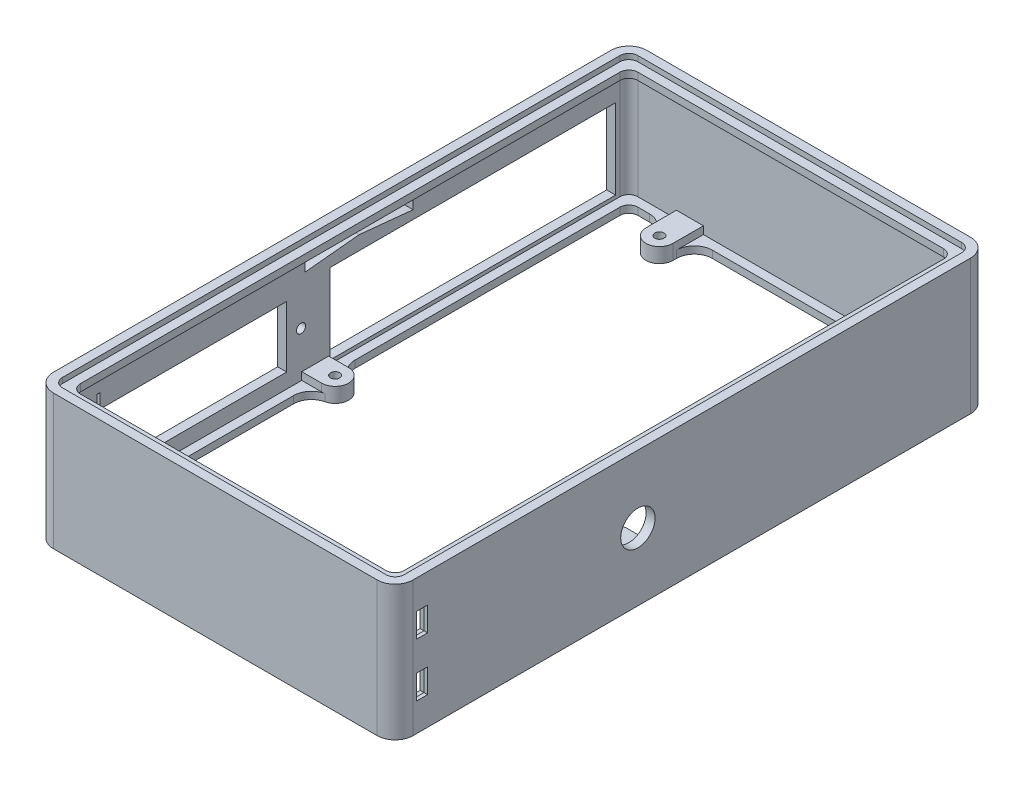
from build123d import *

# Parameters (mm, degrees)
SKETCH1_W            = 200
SKETCH1_H            = 330
BOSS_EXTRUDE1_DEPTH  = 75
FILLET1_R            = 10
CUT_EXTRUDE1_DEPTH   = 75
SKETCH3_W            = 180
SKETCH3_H            = 310
BOSS_EXTRUDE2_DEPTH  = 4
BOSS_EXTRUDE3_START  = -4
SKETCH4_W            = 180
SKETCH4_H            = 310
BOSS_EXTRUDE3_DEPTH  = 4
SKETCH8_W            = 158.75
SKETCH8_H            = 44.5
CUT_EXTRUDE2_DEPTH   = 40
BOSS_EXTRUDE4_START  = -8.23
SKETCH11_R           = 2.55
BOSS_EXTRUDE4_DEPTH  = 8.23
SKETCH12_R           = 2.55
SKETCH12_W           = 101.8
SKETCH12_H           = 34
CUT_EXTRUDE3_DEPTH   = 31.23
SKETCH13_R           = 9.55
CUT_EXTRUDE4_DEPTH   = 31.23
FILLET2_R            = 10
FILLET3_R            = 20
FILLET4_R            = 5
CUT_EXTRUDE5_DEPTH   = 10
SKETCH15_W           = 2
SKETCH15_H           = 47.02140159
BOSS_EXTRUDE5_DEPTH  = 8
SKETCH16_R           = 2.55
CUT_EXTRUDE6_DEPTH   = 2
BOSS_EXTRUDE6_START  = 3
SKETCH17_R           = 4.5
SKETCH17_R_2         = 2.55
BOSS_EXTRUDE6_DEPTH  = 3
CHAMFER1_SIZE        = 3
FILLET5_R            = 5
CHAMFER2_SIZE        = 3
SKETCH19_W           = 7
SKETCH19_H           = 14.5
CUT_EXTRUDE8_DEPTH   = 18
SKETCH22_W           = 7
SKETCH22_H           = 0.375
CUT_EXTRUDE9_DEPTH   = 18
SKETCH23_W           = 7
SKETCH23_H           = 0.375
BOSS_EXTRUDE7_DEPTH  = 5
SKETCH20_R           = 2.55
CUT_EXTRUDE10_DEPTH  = 18
SKETCH24_W           = 8
SKETCH24_H           = 15.5
CUT_EXTRUDE12_DEPTH  = 10
SKETCH25_W           = 8
SKETCH25_H           = 0.4
BOSS_EXTRUDE8_DEPTH  = 5
SKETCH26_W           = 0.1
SKETCH26_H           = 15.1
BOSS_EXTRUDE9_DEPTH  = 5
BOSS_EXTRUDE10_DEPTH = 2
SKETCH28_W           = 12.985784693
SKETCH28_H           = 10.415883014
BOSS_EXTRUDE11_DEPTH = 5
BOSS_EXTRUDE12_START = -0.6
SKETCH29_R           = 2.55
BOSS_EXTRUDE12_DEPTH = 0.6
CUT_EXTRUDE13_DEPTH  = 5


with BuildPart() as part:
    # Sketch1 → Boss-Extrude1 (new body)
    with BuildSketch(Plane(origin=(0, 0, 0), x_dir=(1, 0, 0), z_dir=(0, 1, 0))):
        with Locations((100, 165)):
            Rectangle(SKETCH1_W, SKETCH1_H)
    extrude(amount=BOSS_EXTRUDE1_DEPTH)

    # Fillet1
    fillet1_edges = [part.edges().sort_by_distance(p)[0] for p in [
        (0, 37.5, -330),
        (200, 37.5, -330),
        (200, 37.5, 0),
        (0, 37.5, 0),
    ]]
    fillet(fillet1_edges, radius=FILLET1_R)

    # Sketch2 → Cut-Extrude1 (cut)
    with BuildSketch(Plane(origin=(0, 75, 0), x_dir=(1, 0, 0), z_dir=(0, 1, 0))):
        with BuildLine():
            Line((190, 325), (10, 325))
            ThreePointArc((10, 325), (6.464466094, 323.535533906), (5, 320))
            Line((5, 320), (5, 10))
            ThreePointArc((5, 10), (6.464466094, 6.464466094), (10, 5))
            Line((10, 5), (190, 5))
            ThreePointArc((190, 5), (193.535533906, 6.464466094), (195, 10))
            Line((195, 10), (195, 320))
            ThreePointArc((195, 320), (193.535533906, 323.535533906), (190, 325))
        make_face()
    extrude(amount=-CUT_EXTRUDE1_DEPTH, mode=Mode.SUBTRACT)

    # Sketch3 → Boss-Extrude2 (add)
    with BuildSketch(Plane(origin=(0, 72, 0), x_dir=(1, 0, 0), z_dir=(0, 1, 0))):
        with BuildLine():
            Line((10, 5), (190, 5))
            ThreePointArc((190, 5), (193.535533906, 6.464466094), (195, 10))
            Line((195, 10), (195, 320))
            ThreePointArc((195, 320), (193.535533906, 323.535533906), (190, 325))
            Line((190, 325), (10, 325))
            ThreePointArc((10, 325), (6.464466094, 323.535533906), (5, 320))
            Line((5, 320), (5, 10))
            ThreePointArc((5, 10), (6.464466094, 6.464466094), (10, 5))
        make_face()
        with Locations((100, 165)):
            Rectangle(SKETCH3_W, SKETCH3_H, mode=Mode.SUBTRACT)
    extrude(amount=-BOSS_EXTRUDE2_DEPTH)

    # Sketch4 → Boss-Extrude3 (add)
    with BuildSketch(Plane(origin=(0, 3, 0), x_dir=(-1, 0, 0), z_dir=(0, -1, 0)).offset(BOSS_EXTRUDE3_START)):
        with BuildLine():
            Line((-5, 10), (-5, 320))
            ThreePointArc((-5, 320), (-6.464466094, 323.535533906), (-10, 325))
            Line((-10, 325), (-190, 325))
            ThreePointArc((-190, 325), (-193.535533906, 323.535533906), (-195, 320))
            Line((-195, 320), (-195, 10))
            ThreePointArc((-195, 10), (-193.535533906, 6.464466094), (-190, 5))
            Line((-190, 5), (-10, 5))
            ThreePointArc((-10, 5), (-6.464466094, 6.464466094), (-5, 10))
        make_face()
        with Locations((-100, 165)):
            Rectangle(SKETCH4_W, SKETCH4_H, mode=Mode.SUBTRACT)
    extrude(amount=BOSS_EXTRUDE3_DEPTH)

    # Sketch8 → Cut-Extrude2 (cut)
    with BuildSketch(Plane(origin=(5, 0, 0), x_dir=(0, 0, -1), z_dir=(1, 0, 0))):
        with Locations((238.245, 31.25)):
            Rectangle(SKETCH8_W, SKETCH8_H)
    extrude(amount=-CUT_EXTRUDE2_DEPTH, mode=Mode.SUBTRACT)

    # Sketch11 → Boss-Extrude4 (add)
    # profile 1 of 4: a face of its own
    with BuildSketch(Plane.XZ.offset(-3).offset(BOSS_EXTRUDE4_START)):
        with BuildLine():
            Line((16.06, -158.09), (10, -158.09))
            Line((10, -158.09), (5, -158.09))
            Line((5, -158.09), (5, -143.09))
            Line((5, -143.09), (10, -143.09))
            Line((10, -143.09), (16.06, -143.09))
            ThreePointArc((16.06, -143.09), (23.56, -150.59), (16.06, -158.09))
        make_face()
        with Locations(Location((16.06, -150.59, 0), (0, 0, 270))):
            Circle(SKETCH11_R, mode=Mode.SUBTRACT)
    # profile 2 of 4: a face of its own
    with BuildSketch(Plane.XZ.offset(-3).offset(BOSS_EXTRUDE4_START)):
        with BuildLine():
            Line((31.42, -308.07), (31.42, -320))
            Line((31.42, -320), (31.42, -325))
            Line((31.42, -325), (46.42, -325))
            Line((46.42, -325), (46.42, -320))
            Line((46.42, -320), (46.42, -308.07))
            ThreePointArc((46.42, -308.07), (38.92, -300.57), (31.42, -308.07))
        make_face()
        with Locations(Location((38.92, -308.07, 0), (0, 0, 270))):
            Circle(SKETCH11_R, mode=Mode.SUBTRACT)
    # profile 3 of 4: a face of its own
    with BuildSketch(Plane.XZ.offset(-3).offset(BOSS_EXTRUDE4_START)):
        with BuildLine():
            Line((171, -300.57), (190, -300.57))
            Line((190, -300.57), (195, -300.57))
            Line((195, -300.57), (195, -320))
            ThreePointArc((195, -320), (193.535533906, -323.535533906), (190, -325))
            Line((190, -325), (163.5, -325))
            Line((163.5, -325), (163.5, -320))
            Line((163.5, -320), (163.5, -308.07))
            ThreePointArc((163.5, -308.07), (165.696699141, -302.766699141), (171, -300.57))
        make_face()
        with Locations(Location((171, -308.07, 0), (0, 0, 270))):
            Circle(SKETCH11_R, mode=Mode.SUBTRACT)
    # profile 4 of 4: a face of its own
    with BuildSketch(Plane.XZ.offset(-3).offset(BOSS_EXTRUDE4_START)):
        with BuildLine():
            Line((171, -158.09), (190, -158.09))
            Line((190, -158.09), (195, -158.09))
            Line((195, -158.09), (195, -143.09))
            Line((195, -143.09), (190, -143.09))
            Line((190, -143.09), (171, -143.09))
            ThreePointArc((171, -143.09), (163.5, -150.59), (171, -158.09))
        make_face()
        with Locations(Location((171, -150.59, 0), (0, 0, 270))):
            Circle(SKETCH11_R, mode=Mode.SUBTRACT)
    extrude(amount=BOSS_EXTRUDE4_DEPTH)

    # Sketch12 → Cut-Extrude3 (cut)
    with BuildSketch(Plane.ZY):
        with Locations((-142.7, 32.25)):
            Circle(SKETCH12_R)
        with Locations((-83.8, 32.25)):
            Rectangle(SKETCH12_W, SKETCH12_H)
    extrude(amount=-CUT_EXTRUDE3_DEPTH, mode=Mode.SUBTRACT)

    # Sketch13 → Cut-Extrude4 (cut)
    with BuildSketch(Plane.ZY.offset(-195)):
        with Locations((-135, 37.5)):
            Circle(SKETCH13_R)
    extrude(amount=-CUT_EXTRUDE4_DEPTH, mode=Mode.SUBTRACT)

    # Fillet2
    # the kernel refuses this fillet: 10 mm, written as the material it adds along each edge
    with BuildSketch(Plane(origin=(31.42, 3, -320), x_dir=(0, 0, 1), z_dir=(0, 1, 0))) as fillet2_piece_1:
        with BuildLine():
            CenterArc((FILLET2_R, -FILLET2_R), FILLET2_R, 90, 90)
            Line((0, -FILLET2_R), (0, 0))
            Line((0, 0), (FILLET2_R, 0))
        make_face()
    extrude(amount=4)
    with BuildSketch(Plane(origin=(46.42, 7, -320), x_dir=(1, 0, 0), z_dir=(0, -1, 0))) as fillet2_piece_2:
        with BuildLine():
            CenterArc((FILLET2_R, FILLET2_R), FILLET2_R, 180, 90)
            Line((0, FILLET2_R), (0, 0))
            Line((0, 0), (FILLET2_R, 0))
        make_face()
    extrude(amount=4)
    with BuildSketch(Plane(origin=(10, 7, -143.09), x_dir=(0.9996913663867205, 0, -0.02484294611859972), z_dir=(0, -1, 0))) as fillet2_piece_3:
        with BuildLine():
            CenterArc((9.759646117, 9.796182659), FILLET2_R, 181.423542417, 76.988721184)
            Line((-0.237267547, 9.547753198), (-1.236958913, 9.522910252))
            Line((-1.236958913, 9.522910252), (-0.999691366, -0.024842946))
            Line((-0.999691366, -0.024842946), (0.024842946, -0.999691366))
            ThreePointArc((0.024842946, -0.999691366), (6.082972626, -0.849143113), (7.550095388, -0.979618266))
            Line((7.550095388, -0.979618266), (7.750963636, 0))
        make_face()
    extrude(amount=4)
    with BuildSketch(Plane(origin=(10, 3, -158.09), x_dir=(0, 0, -1), z_dir=(0, 1, 0))) as fillet2_piece_4:
        with BuildLine():
            CenterArc((9.550700865, -10), FILLET2_R, 90, 76.988721184)
            Line((-0.192556772, -7.748571429), (-1.166882536, -7.523428571))
            ThreePointArc((-1.166882536, -7.523428571), (-1, -6.06), (-1, 0))
            Line((-1, 0), (0, 1))
            Line((0, 1), (9.550700865, 1))
            Line((9.550700865, 1), (9.550700865, 0))
        make_face()
    extrude(amount=4)

    # Fillet3
    # the kernel refuses this fillet: 20 mm, written as the material it adds along each edge
    with BuildSketch(Plane(origin=(190, 7, -143.09), x_dir=(-0.9999999668790588, 0, -0.00025737498219353277), z_dir=(0, -1, 0))) as fillet3_piece_1:
        with BuildLine():
            CenterArc((19.994856519, -19.986959005), FILLET3_R, 92.069195834, 87.916057665)
            Line((-0.005142819, -19.981811506), (-2.005142752, -19.981296756))
            Line((-2.005142752, -19.981296756), (-1.999999934, 0.00051475))
            Line((-1.999999934, 0.00051475), (0.00051475, 1.999999934))
            ThreePointArc((0.00051475, 1.999999934), (19.000514121, 1.995109809), (19.20051505, 1.998695901))
            Line((19.20051505, 1.998695901), (19.272727911, 0))
        make_face()
    extrude(amount=4)
    with BuildSketch(Plane(origin=(190, 3, -158.09), x_dir=(0, 0, -1), z_dir=(0, 1, 0))) as fillet3_piece_2:
        with BuildLine():
            CenterArc((19.981812167, 20), FILLET3_R, 182.083942335, 87.916057665)
            Line((-0.004960318, 19.272727273), (-2.003637567, 19.2))
            ThreePointArc((-2.003637567, 19.2), (-2, 19), (-2, 0))
            Line((-2, 0), (0, -2))
            Line((0, -2), (19.981812167, -2))
            Line((19.981812167, -2), (19.981812167, 0))
        make_face()
    extrude(amount=4)

    # Fillet4
    fillet4_edges = [part.edges().sort_by_distance(p)[0] for p in [
        (10, 5, -320),
        (10, 5, -10),
        (190, 5, -10),
        (10, 70, -10),
        (10, 70, -320),
        (190, 70, -320),
        (190, 70, -10),
    ]]
    fillet(fillet4_edges, radius=FILLET4_R)

    # Sketch14 → Cut-Extrude5 (cut)
    with BuildSketch(Plane.ZY):
        Polygon((-30.9, 49.25), (-30.9, 15.25), (-30.9, 10.25), (-29.15, 10.25), (-29.15, 57.25), (-30.9, 57.25), align=None)
    extrude(amount=-CUT_EXTRUDE5_DEPTH, mode=Mode.SUBTRACT)

    # Sketch15 → Boss-Extrude5 (add)
    with BuildSketch(Plane.ZY):
        with Locations((-31.9, 33.760700795)):
            Rectangle(SKETCH15_W, SKETCH15_H)
    extrude(amount=BOSS_EXTRUDE5_DEPTH)

    # Sketch16 → Cut-Extrude6 (cut)
    with BuildSketch(Plane(origin=(0, 0, -32.9), x_dir=(-1, 0, 0), z_dir=(0, 0, -1))):
        with Locations((0.5, 31.75)):
            Circle(SKETCH16_R)
    extrude(amount=-CUT_EXTRUDE6_DEPTH, mode=Mode.SUBTRACT)

    # Sketch17 → Boss-Extrude6 (add)
    with BuildSketch(Plane(origin=(0, 0, -32.9), x_dir=(-1, 0, 0), z_dir=(0, 0, -1)).offset(BOSS_EXTRUDE6_START)):
        with Locations((0.5, 31.75)):
            Circle(SKETCH17_R)
        with Locations((0.5, 31.75)):
            Circle(SKETCH17_R_2, mode=Mode.SUBTRACT)
    extrude(amount=-BOSS_EXTRUDE6_DEPTH)

    # Chamfer1
    # the kernel refuses this chamfer: 3 mm, written as the material it adds along each edge
    with BuildSketch(Plane(origin=(-0.5, 31.75, -32.9), x_dir=(-1, 0, 0), z_dir=(0, -1, 0))) as chamfer1_piece_1_section:
        Polygon((4.5, CHAMFER1_SIZE), (4.5 + CHAMFER1_SIZE, 0), (4.5, 0), align=None)
    chamfer1_piece_1 = revolve(axis=Axis((-0.5, 31.75, -32.9), (0, 0, -1)), mode=Mode.PRIVATE)
    chamfer1_piece_1 = split(chamfer1_piece_1, bisect_by=Plane(origin=(5, 36.059247984, -35.347606696), z_dir=(-1, 0, 0)), keep=Keep.TOP, mode=Mode.PRIVATE)
    chamfer1_piece_1 = split(chamfer1_piece_1, bisect_by=Plane(origin=(-8, 36.059247984, -35.347606696), z_dir=(1, 0, 0)), keep=Keep.TOP, mode=Mode.PRIVATE)
    chamfer1_piece_1 = split(chamfer1_piece_1, bisect_by=Plane(origin=(-2.987945483, 36.059247984, -35.9), z_dir=(0, 0, 1)), keep=Keep.TOP, mode=Mode.PRIVATE)
    add(chamfer1_piece_1)

    # Fillet5
    fillet5_edges = [part.edges().sort_by_distance(p)[0] for p in [
        (-8, 57.27140159, -31.9),
        (-8, 10.25, -31.9),
    ]]
    fillet(fillet5_edges, radius=FILLET5_R)

    # Chamfer2
    chamfer2_edges = [part.edges().sort_by_distance(p)[0] for p in [
        (0, 53.260700795, -32.9),
        (0, 12.75, -32.9),
    ]]
    chamfer(chamfer2_edges, length=CHAMFER2_SIZE)

    # Sketch19 → Cut-Extrude8 (cut)
    with BuildSketch(Plane(origin=(200, 0, 0), x_dir=(0, 0, -1), z_dir=(1, 0, 0))):
        with Locations((15, 52)):
            Rectangle(SKETCH19_W, SKETCH19_H)
        with Locations((15, 22.25)):
            Rectangle(SKETCH19_W, SKETCH19_H)
    extrude(amount=-CUT_EXTRUDE8_DEPTH, mode=Mode.SUBTRACT)

    # Sketch22 → Cut-Extrude9 (cut)
    with BuildSketch(Plane(origin=(200, 0, 0), x_dir=(0, 0, -1), z_dir=(1, 0, 0))):
        with Locations((15, 59.4375)):
            Rectangle(SKETCH22_W, SKETCH22_H)
        with Locations((15, 29.6875)):
            Rectangle(SKETCH22_W, SKETCH22_H)
    extrude(amount=-CUT_EXTRUDE9_DEPTH, mode=Mode.SUBTRACT)

    # Sketch23 → Boss-Extrude7 (add)
    with BuildSketch(Plane(origin=(200, 0, 0), x_dir=(0, 0, -1), z_dir=(1, 0, 0))):
        with Locations((15, 44.9375)):
            Rectangle(SKETCH23_W, SKETCH23_H)
        with Locations((15, 15.1875)):
            Rectangle(SKETCH23_W, SKETCH23_H)
    extrude(amount=-BOSS_EXTRUDE7_DEPTH)

    # Sketch20 → Cut-Extrude10 (cut)
    with BuildSketch(Plane(origin=(0, 0, -5), x_dir=(-1, 0, 0), z_dir=(0, 0, -1))):
        with Locations((-178, 37.125)):
            Circle(SKETCH20_R)
        with Locations((-168, 62.125)):
            Circle(SKETCH20_R)
        with Locations((-168, 12.125)):
            Circle(SKETCH20_R)
    extrude(amount=-CUT_EXTRUDE10_DEPTH, mode=Mode.SUBTRACT)

    # Sketch24 → Cut-Extrude12 (cut)
    with BuildSketch(Plane(origin=(200, 0, 0), x_dir=(0, 0, -1), z_dir=(1, 0, 0))):
        with Locations((15, 22.625)):
            Rectangle(SKETCH24_W, SKETCH24_H)
        with Locations((15, 52.375)):
            Rectangle(SKETCH24_W, SKETCH24_H)
    extrude(amount=-CUT_EXTRUDE12_DEPTH, mode=Mode.SUBTRACT)

    # Sketch25 → Boss-Extrude8 (add)
    with BuildSketch(Plane(origin=(200, 0, 0), x_dir=(0, 0, -1), z_dir=(1, 0, 0))):
        with Locations((15, 59.925)):
            Rectangle(SKETCH25_W, SKETCH25_H)
        with Locations((15, 30.175)):
            Rectangle(SKETCH25_W, SKETCH25_H)
    extrude(amount=-BOSS_EXTRUDE8_DEPTH)

    # Sketch26 → Boss-Extrude9 (add)
    with BuildSketch(Plane(origin=(200, 0, 0), x_dir=(0, 0, -1), z_dir=(1, 0, 0))):
        with Locations((11.05, 52.175)):
            Rectangle(SKETCH26_W, SKETCH26_H)
        with Locations((18.95, 52.175)):
            Rectangle(SKETCH26_W, SKETCH26_H)
        with Locations((18.95, 22.425)):
            Rectangle(SKETCH26_W, SKETCH26_H)
        with Locations((11.05, 22.425)):
            Rectangle(SKETCH26_W, SKETCH26_H)
    extrude(amount=-BOSS_EXTRUDE9_DEPTH)

    # Sketch27 → Boss-Extrude10 (add)
    with BuildSketch(Plane(origin=(200, 0, 0), x_dir=(0, 0, -1), z_dir=(1, 0, 0))):
        Polygon((18.05, 22.425), (18.9, 22.425), (18.9, 29.975), (11.1, 29.975), (11.1, 22.425), (11.95, 22.425), (11.95, 29.125), (15, 29.125), (18.05, 29.125), align=None)
        Polygon((18.9, 14.875), (18.9, 22.425), (18.05, 22.425), (18.05, 15.725), (11.95, 15.725), (11.95, 22.425), (11.1, 22.425), (11.1, 14.875), align=None)
        Polygon((18.9, 44.625), (18.9, 52.175), (18.05, 52.175), (18.05, 45.475), (11.95, 45.475), (11.95, 52.175), (11.1, 52.175), (11.1, 44.625), align=None)
        Polygon((18.05, 52.175), (18.9, 52.175), (18.9, 59.725), (11.1, 59.725), (11.1, 52.175), (11.95, 52.175), (11.95, 58.875), (15, 58.875), (18.05, 58.875), align=None)
    extrude(amount=-BOSS_EXTRUDE10_DEPTH)

    # Sketch28 → Boss-Extrude11 (add)
    with BuildSketch(Plane(origin=(0, 0, -5), x_dir=(-1, 0, 0), z_dir=(0, 0, -1))):
        with Locations((-176.768468334, 36.353971187)):
            Rectangle(SKETCH28_W, SKETCH28_H)
    extrude(amount=-BOSS_EXTRUDE11_DEPTH)

    # Sketch29 → Boss-Extrude12 (add)
    with BuildSketch(Plane.XY.offset(BOSS_EXTRUDE12_START)):
        with Locations(Location((168, 62.125, 0), (0, 0, 180))):
            Circle(SKETCH29_R)
        with Locations(Location((168, 12.125, 0), (0, 0, 180))):
            Circle(SKETCH29_R)
    extrude(amount=BOSS_EXTRUDE12_DEPTH)

    # Sketch31 → Cut-Extrude13 (cut)
    with BuildSketch(Plane.ZY):
        Polygon((-175, 61.25), (-175, 64.25), (-205, 64.25), (-205, 58.25), align=None)
        Polygon((-205, 64.25), (-175, 64.25), (-175, 67.25), (-205, 70.25), align=None)
        Polygon((-145, 64.25), (-175, 64.25), (-175, 61.25), (-145, 58.25), align=None)
        Polygon((-175, 67.25), (-175, 64.25), (-145, 64.25), (-145, 70.25), align=None)
    extrude(amount=-CUT_EXTRUDE13_DEPTH, mode=Mode.SUBTRACT)


solid = part.part
